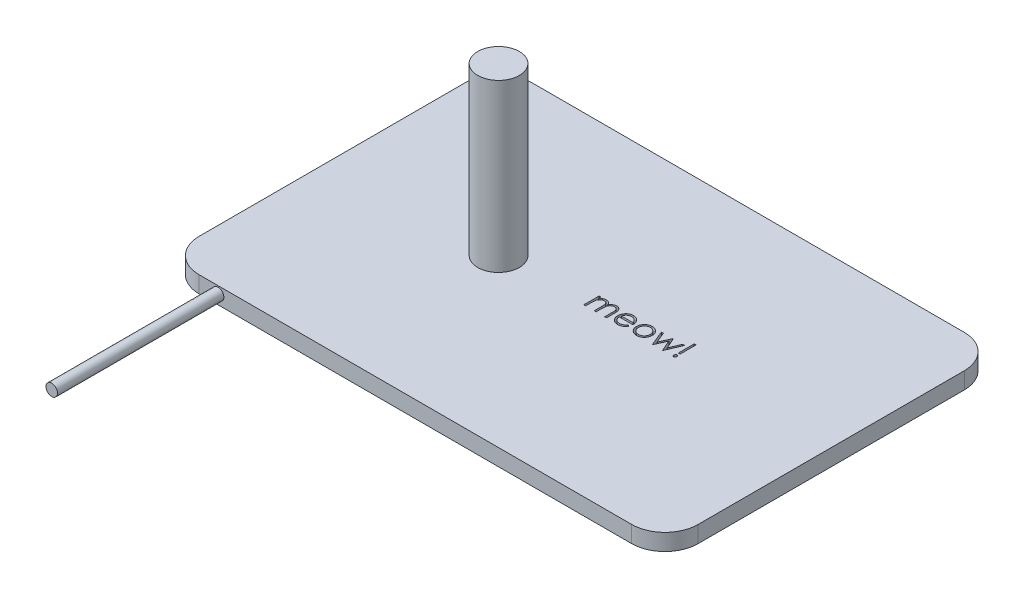
from build123d import *

# Parameters (mm, degrees)
SKETCH2_W           = 76.2
SKETCH2_H           = 50.8
BOSS_EXTRUDE1_DEPTH = 2.54
FILLET1_R           = 5.08
SKETCH3_R           = 3.175
BOSS_EXTRUDE2_DEPTH = 25.4
SKETCH5_W           = 0.284935898
SKETCH5_H           = 2.442307692
CUT_EXTRUDE1_DEPTH  = 53.363441445
SKETCH6_R           = 0.881534842
BOSS_EXTRUDE3_DEPTH = 25.4


with BuildPart() as part:
    # Sketch2 → Boss-Extrude1 (new body)
    with BuildSketch(Plane(origin=(0, 0, 0), x_dir=(1, 0, 0), z_dir=(0, 1, 0))):
        Rectangle(SKETCH2_W, SKETCH2_H)
    extrude(amount=BOSS_EXTRUDE1_DEPTH)

    # Fillet1
    fillet1_edges = [part.edges().sort_by_distance(p)[0] for p in [
        (38.1, 1.27, -25.4),
        (38.1, 1.27, 25.4),
        (-38.1, 1.27, -25.4),
        (-38.1, 1.27, 25.4),
    ]]
    fillet(fillet1_edges, radius=FILLET1_R)

    # Sketch3 → Boss-Extrude2 (add)
    with BuildSketch(Plane(origin=(0, 2.54, 0), x_dir=(1, 0, 0), z_dir=(0, 1, 0))):
        with Locations((-12.7, 0)):
            Circle(SKETCH3_R)
    extrude(amount=BOSS_EXTRUDE2_DEPTH)

    # Sketch5 → Cut-Extrude1 (cut, through all)
    # profile 1 of 6: a face of its own
    with BuildSketch(Plane(origin=(0, 2.54, 0), x_dir=(1, 0, 0), z_dir=(0, 1, 0))):
        with BuildLine():
            Line((0.325641026, 2.320192308), (0.610576923, 2.320192308))
            Line((0.610576923, 2.320192308), (0.610576923, 1.916957131))
            add(Edge.make_bspline(
                [(0.610576923, 1.916957131), (0.636234506, 1.952233742), (0.685396895, 2.019827109), (0.766010737, 2.108899724), (0.846543354, 2.184490264), (0.904540064, 2.224171297), (0.932401843, 2.243234175)],
                knots=[0, 0, 0, 0, 1.134379233, 2.173579362, 3.122582517, 4, 4, 4, 4], degree=3))
            add(Edge.make_bspline(
                [(0.932401843, 2.243234175), (0.970379072, 2.261381899), (1.045670024, 2.297360285), (1.164886035, 2.333857871), (1.286873771, 2.35628707), (1.369249794, 2.359354459), (1.410687099, 2.360897436)],
                knots=[0, 0, 0, 0, 1.014936303, 2.012140481, 3.000054389, 4, 4, 4, 4], degree=3))
            add(Edge.make_bspline(
                [(1.410687099, 2.360897436), (1.438711461, 2.359949208), (1.494170164, 2.358072715), (1.576342875, 2.345862541), (1.656043187, 2.324756798), (1.732800199, 2.295358726), (1.805118244, 2.259756374), (1.871420588, 2.21798271), (1.930951119, 2.171086078), (1.983679752, 2.11694876), (2.031095225, 2.05405056), (2.074709607, 1.980695134), (2.115009621, 1.895235327), (2.137344665, 1.833217108), (2.149103566, 1.800565905)],
                knots=[0, 0, 0, 0, 1.009824226, 1.998387844, 2.986035974, 3.974953746, 4.955485308, 5.885931332, 6.793869504, 7.679848016, 8.601185859, 9.625726857, 10.749998409, 12, 12, 12, 12], degree=3))
            add(Edge.make_bspline(
                [(2.149103566, 1.800565905), (2.161541629, 1.822994486), (2.186017992, 1.867130782), (2.227116677, 1.929595063), (2.27017675, 1.988021224), (2.315565183, 2.042455623), (2.363121772, 2.09262945), (2.413070328, 2.13870859), (2.465126523, 2.180890926), (2.537509483, 2.230169792), (2.631682348, 2.282513007), (2.750416567, 2.327895953), (2.873924222, 2.355941298), (2.957760277, 2.359234474), (3.000095152, 2.360897436)],
                knots=[0, 0, 0, 0, 0.86119277, 1.694706429, 2.50939023, 3.298075842, 4.073795165, 4.829715201, 5.57930267, 6.321991688, 7.768977793, 9.186738141, 10.579381044, 12, 12, 12, 12], degree=3))
            add(Edge.make_bspline(
                [(3.000095152, 2.360897436), (3.038994765, 2.359430386), (3.115125084, 2.356559226), (3.225957318, 2.334013575), (3.329318813, 2.295298852), (3.425001589, 2.242472625), (3.511325134, 2.176088651), (3.586360643, 2.097104777), (3.64965233, 2.006079683), (3.690998667, 1.920452665), (3.719043228, 1.844855613), (3.736334491, 1.780442763), (3.7516105, 1.70954814), (3.764293487, 1.632086974), (3.773563173, 1.547785637), (3.780430894, 1.456782085), (3.78507916, 1.359005591), (3.785407612, 1.291545459), (3.785576923, 1.256770833)],
                knots=[0, 0, 0, 0, 1.209669288, 2.367440248, 3.500751976, 4.631527125, 5.755587489, 6.87532382, 8.007944318, 9.190864318, 9.82315674, 10.514484317, 11.263564316, 12.079023757, 12.955305781, 13.901327259, 14.918167583, 16, 16, 16, 16], degree=3))
            Line((3.785576923, 1.256770833), (3.785576923, 0))
            Line((3.785576923, 0), (3.500641026, 0))
            Line((3.500641026, 0), (3.500641026, 1.258042869))
            add(Edge.make_bspline(
                [(3.500641026, 1.258042869), (3.500570375, 1.287725104), (3.500434594, 1.344769845), (3.497991086, 1.426641711), (3.493387051, 1.501270864), (3.488003486, 1.568555544), (3.480525173, 1.628652659), (3.470867792, 1.681441496), (3.460637325, 1.727337311), (3.443641105, 1.778215368), (3.416474089, 1.834340488), (3.375092517, 1.894868303), (3.322958921, 1.947555886), (3.262760779, 1.993292502), (3.194227547, 2.030479591), (3.118694548, 2.057037114), (3.03663073, 2.073477153), (2.979822915, 2.075115467), (2.950485777, 2.075961538)],
                knots=[0, 0, 0, 0, 1.253487763, 2.409012846, 3.458416907, 4.410876679, 5.259312806, 6.014470957, 6.676830364, 7.243083969, 8.276244668, 9.299465089, 10.325150304, 11.392391894, 12.482080715, 13.603491619, 14.762376348, 16, 16, 16, 16], degree=3))
            add(Edge.make_bspline(
                [(2.950485777, 2.075961538), (2.914499461, 2.074676881), (2.843376821, 2.072137911), (2.739558415, 2.046217326), (2.639798993, 2.007137384), (2.547075265, 1.950502227), (2.461778627, 1.882640354), (2.388391153, 1.801950363), (2.327764813, 1.710664644), (2.286712992, 1.626167278), (2.260778411, 1.55026714), (2.243654352, 1.483957381), (2.230334418, 1.40859053), (2.217842581, 1.324673021), (2.209689428, 1.231627214), (2.202279547, 1.129883522), (2.198813479, 1.01913593), (2.198328648, 0.942367434), (2.198076923, 0.902509014)],
                knots=[0, 0, 0, 0, 1.090531906, 2.155305635, 3.229839962, 4.33261226, 5.44038871, 6.529323825, 7.629011124, 8.757537029, 9.370236727, 10.061839251, 10.834451254, 11.692844982, 12.636905849, 13.66920014, 14.789842145, 16, 16, 16, 16], degree=3))
            Line((2.198076923, 0.902509014), (2.198076923, 0))
            Line((2.198076923, 0), (1.913141026, 0))
            Line((1.913141026, 0), (1.913141026, 1.1798127))
            add(Edge.make_bspline(
                [(1.913141026, 1.1798127), (1.91306897, 1.213098782), (1.912930343, 1.277137859), (1.910502541, 1.368971264), (1.905888249, 1.452501958), (1.900553751, 1.527632857), (1.892879161, 1.59422742), (1.884161734, 1.652642665), (1.873866923, 1.702732146), (1.856821813, 1.757671788), (1.830773688, 1.818197197), (1.788874336, 1.882732266), (1.736616031, 1.939218326), (1.675319594, 1.987440905), (1.606371582, 2.027302106), (1.53018664, 2.056022023), (1.447450755, 2.072735486), (1.390411693, 2.074865908), (1.361077724, 2.075961538)],
                knots=[0, 0, 0, 0, 1.320475261, 2.540461679, 3.643808994, 4.639130445, 5.527981419, 6.302341397, 6.981980563, 7.553956391, 8.582137848, 9.585246428, 10.591171744, 11.620968678, 12.668337649, 13.738356861, 14.836885341, 16, 16, 16, 16], degree=3))
            add(Edge.make_bspline(
                [(1.361077724, 2.075961538), (1.32659159, 2.074573193), (1.257861948, 2.071806269), (1.156895161, 2.04690132), (1.059390291, 2.007890481), (0.966902814, 1.953770502), (0.88192698, 1.886733481), (0.807533766, 1.807889254), (0.744993046, 1.718219059), (0.703507757, 1.634612676), (0.676748427, 1.560614063), (0.658972659, 1.497702846), (0.643696713, 1.427852621), (0.632344707, 1.350847884), (0.621386045, 1.267190177), (0.616097121, 1.176462747), (0.610952204, 1.078743425), (0.610705085, 1.011276902), (0.610576923, 0.976287059)],
                knots=[0, 0, 0, 0, 1.098833095, 2.189935336, 3.297829714, 4.440610912, 5.596351641, 6.740013378, 7.886572111, 9.072425424, 9.705826452, 10.395263256, 11.156850408, 11.985370555, 12.878090359, 13.847760091, 14.883794034, 16, 16, 16, 16], degree=3))
            Line((0.610576923, 0.976287059), (0.610576923, 0))
            Line((0.610576923, 0), (0.325641026, 0))
            Line((0.325641026, 0), (0.325641026, 2.320192308))
        make_face()
    # profile 2 of 6: a face of its own
    with BuildSketch(Plane(origin=(0, 2.54, 0), x_dir=(1, 0, 0), z_dir=(0, 1, 0))):
        with BuildLine():
            Line((6.341095753, 0.732692308), (6.594230769, 0.599764623))
            add(Edge.make_bspline(
                [(6.594230769, 0.599764623), (6.574059001, 0.563983887), (6.534812727, 0.494368744), (6.46732062, 0.398726985), (6.396570669, 0.312686557), (6.319369212, 0.238546085), (6.238026003, 0.1739109), (6.152089952, 0.117361587), (6.061113667, 0.069175501), (5.965092846, 0.028578565), (5.86322111, -0.002635762), (5.755251592, -0.024683162), (5.640977449, -0.038311413), (5.562649129, -0.039894505), (5.522541066, -0.040705128)],
                knots=[0, 0, 0, 0, 1.120438281, 2.179929193, 3.190490725, 4.156257408, 5.095198341, 6.022838206, 6.959905092, 7.901321166, 8.864066838, 9.862729781, 10.905609505, 12, 12, 12, 12], degree=3))
            add(Edge.make_bspline(
                [(5.522541066, -0.040705128), (5.477962272, -0.039664476), (5.391001959, -0.037634466), (5.264419475, -0.020133445), (5.145239574, 0.008416481), (5.033468957, 0.048299508), (4.929381342, 0.100394295), (4.832769852, 0.163857539), (4.743126425, 0.238363227), (4.663275893, 0.324556715), (4.591390371, 0.416796776), (4.527957662, 0.5129139), (4.474928421, 0.612666254), (4.431791411, 0.7154188), (4.396952712, 0.820523904), (4.372671488, 0.928937878), (4.358674502, 1.040367301), (4.356529612, 1.115748455), (4.355448718, 1.153735978)],
                knots=[0, 0, 0, 0, 1.145258523, 2.234067595, 3.276747158, 4.290159414, 5.277019952, 6.260822364, 7.254936242, 8.264827045, 9.274100331, 10.257902744, 11.220704747, 12.172965371, 13.118907548, 14.062713208, 15.023725156, 16, 16, 16, 16], degree=3))
            add(Edge.make_bspline(
                [(4.355448718, 1.153735978), (4.35640951, 1.189382002), (4.358313674, 1.260027716), (4.370315889, 1.364590031), (4.39158684, 1.466215842), (4.420775363, 1.564989591), (4.458468279, 1.660745898), (4.504580363, 1.753543042), (4.559183449, 1.843282276), (4.601340803, 1.899890833), (4.622576122, 1.928405449)],
                knots=[0, 0, 0, 0, 1.024358464, 2.0301432, 3.019427413, 4.004406732, 4.986367066, 5.972626655, 6.978780325, 8, 8, 8, 8], degree=3))
            add(Edge.make_bspline(
                [(4.622576122, 1.928405449), (4.65133952, 1.962757924), (4.707955164, 2.030374674), (4.803709858, 2.119218727), (4.907396465, 2.193644152), (5.017715583, 2.25533634), (5.135949384, 2.302211719), (5.260508527, 2.337143598), (5.392811308, 2.356717936), (5.483258187, 2.359482757), (5.52953726, 2.360897436)],
                knots=[0, 0, 0, 0, 1.030682036, 2.02871468, 2.997146059, 3.962720338, 4.930598197, 5.918074684, 6.934738563, 8, 8, 8, 8], degree=3))
            add(Edge.make_bspline(
                [(5.52953726, 2.360897436), (5.57711473, 2.35966912), (5.670450882, 2.357259445), (5.806551449, 2.334919842), (5.935330099, 2.299493596), (6.056735299, 2.249461229), (6.170779358, 2.18490935), (6.276720989, 2.104952108), (6.376372004, 2.012044272), (6.434346215, 1.940594789), (6.463847155, 1.904236779)],
                knots=[0, 0, 0, 0, 1.056321875, 2.072262726, 3.055038591, 4.01806755, 4.982017516, 5.957941055, 6.960871419, 8, 8, 8, 8], degree=3))
            add(Edge.make_bspline(
                [(6.463847155, 1.904236779), (6.483919449, 1.876837816), (6.52393043, 1.822222265), (6.574047443, 1.733167001), (6.617551651, 1.639993819), (6.652325123, 1.541196621), (6.680482384, 1.437946002), (6.700853927, 1.329503836), (6.712800653, 1.215902417), (6.715148971, 1.138499042), (6.716346154, 1.099038462)],
                knots=[0, 0, 0, 0, 0.94817472, 1.890038105, 2.849395472, 3.817997239, 4.812318967, 5.836947057, 6.897266129, 8, 8, 8, 8], degree=3))
            Line((6.716346154, 1.099038462), (4.640384615, 1.099038462))
            add(Edge.make_bspline(
                [(4.640384615, 1.099038462), (4.641781258, 1.068467326), (4.6445277, 1.008350421), (4.657332152, 0.920384068), (4.677514968, 0.836588251), (4.705880475, 0.757591491), (4.740231113, 0.682362018), (4.782309585, 0.611457885), (4.832510466, 0.545202048), (4.888504493, 0.483001859), (4.950831644, 0.427611026), (5.016402422, 0.378034057), (5.08615587, 0.336481837), (5.159541988, 0.302754366), (5.236442108, 0.276350779), (5.316880456, 0.258327828), (5.400698748, 0.246256381), (5.457835806, 0.244914113), (5.486924079, 0.244230769)],
                knots=[0, 0, 0, 0, 1.094153842, 2.151609401, 3.174256925, 4.172055639, 5.149267565, 6.128595816, 7.11444997, 8.118368179, 9.117203808, 10.09244225, 11.054858984, 12.015122123, 12.976791628, 13.957293641, 14.960065497, 16, 16, 16, 16], degree=3))
            add(Edge.make_bspline(
                [(5.486924079, 0.244230769), (5.515364048, 0.244782363), (5.571794403, 0.245876832), (5.655832895, 0.256519351), (5.738509467, 0.273728102), (5.81948193, 0.297214021), (5.897106912, 0.325858737), (5.968993947, 0.360423472), (6.035106714, 0.398659314), (6.096898533, 0.442392376), (6.156834363, 0.495921231), (6.216290761, 0.56271935), (6.280041725, 0.641720179), (6.31994657, 0.701179461), (6.341095753, 0.732692308)],
                knots=[0, 0, 0, 0, 0.99110716, 1.966546729, 2.947904876, 3.932708344, 4.903319531, 5.828989031, 6.710028674, 7.56322171, 8.463672341, 9.504779593, 10.677557249, 12, 12, 12, 12], degree=3))
        make_face()
        with BuildLine():
            add(Edge.make_bspline(
                [(6.431410256, 1.383974359), (6.420981176, 1.421768537), (6.400908552, 1.494510165), (6.358965564, 1.595240115), (6.311729238, 1.68476414), (6.255829525, 1.762397092), (6.192493966, 1.831343136), (6.119337265, 1.891594282), (6.03729899, 1.945494398), (5.946803198, 1.990989879), (5.850971008, 2.02971568), (5.750635391, 2.055682749), (5.648257254, 2.073471405), (5.579011152, 2.075127947), (5.544165665, 2.075961538)],
                knots=[0, 0, 0, 0, 1.154881502, 2.222775134, 3.210006277, 4.132804581, 5.035138423, 5.962687519, 6.919655026, 7.923214229, 8.944639381, 9.960483929, 10.97369054, 12, 12, 12, 12], degree=3))
            add(Edge.make_bspline(
                [(5.544165665, 2.075961538), (5.515727246, 2.075406665), (5.45951047, 2.074309797), (5.376687358, 2.063904751), (5.297149345, 2.046705463), (5.220309549, 2.023151538), (5.147174904, 1.991756592), (5.076241079, 1.954941807), (5.009311719, 1.910000514), (4.967454972, 1.875747838), (4.946309095, 1.85844351)],
                knots=[0, 0, 0, 0, 1.04873581, 2.073130211, 3.073294108, 4.04793562, 5.032784715, 6.005352987, 6.992311501, 8, 8, 8, 8], degree=3))
            add(Edge.make_bspline(
                [(4.946309095, 1.85844351), (4.931165903, 1.844750809), (4.900519774, 1.81704012), (4.859570873, 1.769297911), (4.820363729, 1.717816137), (4.784682487, 1.660625203), (4.751954962, 1.598376353), (4.72132984, 1.531594641), (4.693765024, 1.459773302), (4.678256409, 1.409724017), (4.670277444, 1.383974359)],
                knots=[0, 0, 0, 0, 0.879870761, 1.780643979, 2.707998968, 3.669668524, 4.684282772, 5.740141944, 6.837334558, 8, 8, 8, 8], degree=3))
            Line((4.670277444, 1.383974359), (6.431410256, 1.383974359))
        make_face(mode=Mode.SUBTRACT)
    # profile 3 of 6: a face of its own
    with BuildSketch(Plane(origin=(0, 2.54, 0), x_dir=(1, 0, 0), z_dir=(0, 1, 0))):
        with BuildLine():
            add(Edge.make_bspline(
                [(8.40688101, 2.360897436), (8.45041595, 2.359970435), (8.535777329, 2.358152812), (8.660788768, 2.338726379), (8.780118998, 2.309019841), (8.894225044, 2.267952067), (9.001645541, 2.212904869), (9.103945169, 2.147219298), (9.200843456, 2.069402231), (9.25892149, 2.009205983), (9.288401442, 1.978650841)],
                knots=[0, 0, 0, 0, 1.054011418, 2.066658804, 3.057071809, 4.030435133, 4.997543892, 5.974964718, 6.972108034, 8, 8, 8, 8], degree=3))
            add(Edge.make_bspline(
                [(9.288401442, 1.978650841), (9.313785072, 1.949428154), (9.364061088, 1.89154832), (9.428527848, 1.797699299), (9.484064549, 1.700507922), (9.528571663, 1.598683562), (9.563664506, 1.49311511), (9.588579816, 1.383439714), (9.60339975, 1.269899585), (9.605398156, 1.19278896), (9.606410256, 1.153735978)],
                knots=[0, 0, 0, 0, 1.025258237, 2.030674902, 3.01204498, 3.988269485, 4.97094183, 5.956517959, 6.965070386, 8, 8, 8, 8], degree=3))
            add(Edge.make_bspline(
                [(9.606410256, 1.153735978), (9.605520043, 1.11445664), (9.603760941, 1.036838836), (9.58712066, 0.922521268), (9.561238889, 0.811673108), (9.524198579, 0.704758435), (9.476702294, 0.601450442), (9.418744313, 0.502200351), (9.349917918, 0.406812344), (9.271900006, 0.316096391), (9.185674376, 0.232488468), (9.092133298, 0.159619252), (8.993114996, 0.097188297), (8.887302812, 0.046899549), (8.77566302, 0.007248606), (8.657954822, -0.020600694), (8.53436108, -0.037438793), (8.449972101, -0.039601034), (8.40688101, -0.040705128)],
                knots=[0, 0, 0, 0, 0.998656419, 1.973391657, 2.932242238, 3.890759089, 4.846373663, 5.82037756, 6.809684879, 7.83454468, 8.860553229, 9.859544525, 10.845671541, 11.83227036, 12.833544569, 13.85385346, 14.904124723, 16, 16, 16, 16], degree=3))
            add(Edge.make_bspline(
                [(8.40688101, -0.040705128), (8.3635788, -0.039597329), (8.278769234, -0.037427648), (8.154739236, -0.020666113), (8.036820082, 0.007235772), (7.925034139, 0.047029854), (7.818767028, 0.097189905), (7.719174991, 0.159430509), (7.625557925, 0.232510078), (7.539314054, 0.316090535), (7.461301033, 0.406813853), (7.392473375, 0.502199959), (7.334515722, 0.601450544), (7.287019352, 0.704758408), (7.249979064, 0.811673115), (7.224097287, 0.922521266), (7.207457008, 1.036838836), (7.205697906, 1.11445664), (7.204807692, 1.153735978)],
                knots=[0, 0, 0, 0, 1.099876186, 2.154163076, 3.173186993, 4.173200201, 5.163417411, 6.152872554, 7.150605724, 8.17532212, 9.198891216, 10.186952605, 11.159729845, 12.11414092, 13.071450619, 14.029093627, 15.002601286, 16, 16, 16, 16], degree=3))
            add(Edge.make_bspline(
                [(7.204807692, 1.153735978), (7.205826695, 1.192576701), (7.207844146, 1.269474659), (7.222649179, 1.38280135), (7.247467298, 1.492291124), (7.282602208, 1.597452092), (7.32751956, 1.698830237), (7.382275871, 1.796261763), (7.44740023, 1.88968641), (7.497476286, 1.94749144), (7.522816506, 1.976742788)],
                knots=[0, 0, 0, 0, 1.031353054, 2.041901799, 3.029428768, 4.008703097, 4.981709435, 5.96992636, 6.972712378, 8, 8, 8, 8], degree=3))
            add(Edge.make_bspline(
                [(7.522816506, 1.976742788), (7.552252014, 2.007562912), (7.610142119, 2.068176108), (7.707522751, 2.145766326), (7.809570717, 2.212818764), (7.918178328, 2.266772189), (8.032190635, 2.309261415), (8.152132377, 2.33880299), (8.277568023, 2.358082819), (8.363347108, 2.35994988), (8.40688101, 2.360897436)],
                knots=[0, 0, 0, 0, 1.027980169, 2.021703884, 2.998553061, 3.971491411, 4.943284454, 5.930300938, 6.949603206, 8, 8, 8, 8], degree=3))
        make_face()
        with BuildLine():
            add(Edge.make_bspline(
                [(8.405608974, 2.075961538), (8.374822713, 2.075086516), (8.314044932, 2.07335906), (8.22458288, 2.060220089), (8.138458597, 2.039403425), (8.055508689, 2.009826888), (7.976012882, 1.971637172), (7.899895067, 1.924730303), (7.826931354, 1.869727549), (7.758549054, 1.806714983), (7.695790813, 1.737881895), (7.640928649, 1.664540884), (7.594278731, 1.587881555), (7.555416587, 1.507824192), (7.526472209, 1.423557503), (7.505450967, 1.336035787), (7.492324392, 1.245080731), (7.490613177, 1.18324895), (7.48974359, 1.151827925)],
                knots=[0, 0, 0, 0, 1.021534396, 2.016698045, 2.994645724, 3.958388632, 4.93408049, 5.916473867, 6.921342795, 7.962252576, 8.998418191, 10.008913653, 10.997312074, 11.973003931, 12.956656626, 13.948281152, 14.957379055, 16, 16, 16, 16], degree=3))
            add(Edge.make_bspline(
                [(7.48974359, 1.151827925), (7.491201208, 1.111231443), (7.494094309, 1.030655018), (7.517621273, 0.911990642), (7.556978827, 0.798069962), (7.610125859, 0.689560812), (7.676715786, 0.589165246), (7.755171911, 0.499656113), (7.844652211, 0.422380413), (7.944090036, 0.358262789), (8.05145431, 0.307317867), (8.165079687, 0.271214511), (8.283589459, 0.24774519), (8.364579837, 0.245412495), (8.405608974, 0.244230769)],
                knots=[0, 0, 0, 0, 1.016792936, 2.018143844, 3.017858371, 4.030088057, 5.03801393, 6.028138512, 7.003788237, 7.991172063, 8.984598303, 9.972568034, 10.972917682, 12, 12, 12, 12], degree=3))
            add(Edge.make_bspline(
                [(8.405608974, 0.244230769), (8.446635752, 0.245419381), (8.527621471, 0.247765666), (8.645966582, 0.27109631), (8.759281399, 0.307476059), (8.866534158, 0.358205493), (8.965926719, 0.422623898), (9.056050565, 0.499219754), (9.133836805, 0.589402319), (9.200360861, 0.689693792), (9.254378263, 0.79790174), (9.293551596, 0.912011668), (9.317135121, 1.030649663), (9.320020587, 1.111229649), (9.321474359, 1.151827925)],
                knots=[0, 0, 0, 0, 1.02726834, 2.027799167, 3.010890988, 4.004497153, 4.992059811, 5.971914811, 6.958719428, 7.966827853, 8.981595046, 9.981490638, 10.983022906, 12, 12, 12, 12], degree=3))
            add(Edge.make_bspline(
                [(9.321474359, 1.151827925), (9.320605071, 1.183249138), (9.318894445, 1.245081288), (9.305763585, 1.336033657), (9.284758203, 1.423565319), (9.255755378, 1.507795351), (9.217062094, 1.588088837), (9.169512575, 1.664315804), (9.11487443, 1.738135956), (9.051358899, 1.806492473), (8.983047978, 1.869752114), (8.910054693, 1.924751631), (8.834049748, 1.971431021), (8.754784891, 2.01015354), (8.671824348, 2.039134341), (8.585820738, 2.060340285), (8.496740389, 2.073303535), (8.4361804, 2.075069871), (8.405608974, 2.075961538)],
                knots=[0, 0, 0, 0, 1.042956736, 2.052379634, 3.044323526, 4.02829302, 5.004299113, 5.996692471, 7.007513377, 8.048758398, 9.090003419, 10.095195979, 11.07790575, 12.047570684, 13.018257071, 13.989683339, 14.985167495, 16, 16, 16, 16], degree=3))
        make_face(mode=Mode.SUBTRACT)
    # profile 4 of 6: a face of its own
    with BuildSketch(Plane(origin=(0, 2.54, 0), x_dir=(1, 0, 0), z_dir=(0, 1, 0))):
        Polygon((9.850641026, 2.320192308), (10.156565505, 2.320192308), (10.847916667, 0.651282051), (11.605413662, 2.320192308), (11.653751002, 2.320192308), (12.394711538, 0.651282051), (13.092422877, 2.320192308), (13.391987179, 2.320192308), (12.422060296, 0), (12.362910657, 0), (11.621314103, 1.668910256), (10.864453125, 0), (10.811663662, 0), align=None)
    # profile 5 of 6: a face of its own
    with BuildSketch(Plane(origin=(0, 2.54, 0), x_dir=(1, 0, 0), z_dir=(0, 1, 0))):
        with Locations((14.063621795, 2.03525641)):
            Rectangle(SKETCH5_W, SKETCH5_H)
    # profile 6 of 6: a face of its own
    with BuildSketch(Plane(origin=(0, 2.54, 0), x_dir=(1, 0, 0), z_dir=(0, 1, 0))):
        with BuildLine():
            add(Edge.make_bspline(
                [(14.063621795, 0.488461538), (14.078569278, 0.487413648), (14.108075257, 0.485345138), (14.150757886, 0.47077439), (14.189477852, 0.445883687), (14.223400888, 0.41197961), (14.251874104, 0.371816592), (14.272376555, 0.326229442), (14.285850643, 0.276588415), (14.286939885, 0.241778374), (14.2875, 0.223878205)],
                knots=[0, 0, 0, 0, 0.932051743, 1.839848197, 2.779380411, 3.780329255, 4.815317283, 5.833513928, 6.885940208, 8, 8, 8, 8], degree=3))
            add(Edge.make_bspline(
                [(14.2875, 0.223878205), (14.286904548, 0.206407605), (14.285732939, 0.172032518), (14.272407237, 0.122778819), (14.251688337, 0.077127835), (14.223616146, 0.036486799), (14.189475612, 0.002462816), (14.150630253, -0.022208841), (14.108210244, -0.037774948), (14.078591298, -0.03972139), (14.063621795, -0.040705128)],
                knots=[0, 0, 0, 0, 1.089197406, 2.143100788, 3.162726492, 4.210031689, 5.212385385, 6.153236251, 7.066640104, 8, 8, 8, 8], degree=3))
            add(Edge.make_bspline(
                [(14.063621795, -0.040705128), (14.048652292, -0.03972139), (14.019033346, -0.037774948), (13.976613336, -0.022208841), (13.937767978, 0.002462816), (13.903627444, 0.036486799), (13.875555253, 0.077127835), (13.854836353, 0.122778819), (13.841510651, 0.172032518), (13.840339042, 0.206407605), (13.83974359, 0.223878205)],
                knots=[0, 0, 0, 0, 0.933359896, 1.846763749, 2.787614615, 3.789968311, 4.837273508, 5.856899212, 6.910802594, 8, 8, 8, 8], degree=3))
            add(Edge.make_bspline(
                [(13.83974359, 0.223878205), (13.840303704, 0.241778374), (13.841392946, 0.276588415), (13.854867035, 0.326229442), (13.875369486, 0.371816592), (13.903842701, 0.41197961), (13.937765738, 0.445883687), (13.976485703, 0.47077439), (14.019168333, 0.485345138), (14.048674312, 0.487413648), (14.063621795, 0.488461538)],
                knots=[0, 0, 0, 0, 1.114059792, 2.166486072, 3.184682717, 4.219670745, 5.220619589, 6.160151803, 7.067948257, 8, 8, 8, 8], degree=3))
        make_face()
    extrude(amount=-CUT_EXTRUDE1_DEPTH, mode=Mode.SUBTRACT)


with BuildPart() as cut_extrude1_piece_1:
    # of the separate pieces the step leaves, piece 1, a body of its own (cut_extrude1_pieces)
    add(part.part.solids().sort_by_distance((33.02, 0, -25.4))[0])

    # Sketch6 → Boss-Extrude3 (add)
    with BuildSketch(Plane.XY.offset(25.4)):
        with Locations((-30.124068353, 1.45949769)):
            Circle(SKETCH6_R)
    extrude(amount=BOSS_EXTRUDE3_DEPTH)


with BuildPart() as cut_extrude1_piece_2:
    # of the separate pieces the step leaves, piece 2, a body of its own (cut_extrude1_pieces)
    add(part.part.solids().sort_by_distance((7.48974359, 0, -1.151827925))[0])


with BuildPart() as cut_extrude1_piece_3:
    # of the separate pieces the step leaves, piece 3, a body of its own (cut_extrude1_pieces)
    add(part.part.solids().sort_by_distance((5.544165665, 0, -2.075961538))[0])


solid = Compound([cut_extrude1_piece_1.part, cut_extrude1_piece_2.part, cut_extrude1_piece_3.part])
